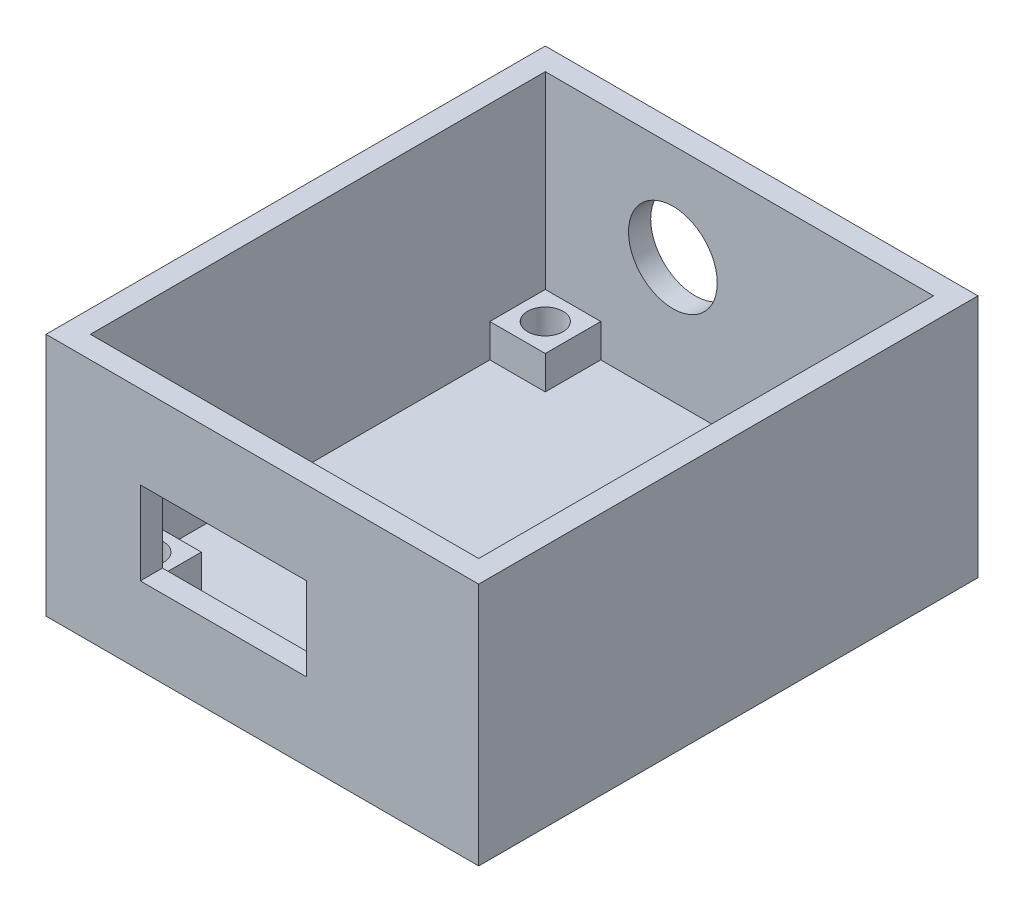
from build123d import *

# Parameters (mm, degrees)
SKETCH1_W             = 39
SKETCH1_H             = 45
BODY_DEPTH            = 22
SHELL1_T              = -2
SKETCH3_W             = 5
SKETCH3_H             = 5
INSERTS_SUPPORT_DEPTH = 3
SKETCH4_R             = 1.6
INSERTS_HOLES_DEPTH   = 4
USB_HOLE_REACH        = 55.752
SKETCH5_W             = 15
SKETCH5_H             = 7.5
JACK_HOLE_REACH       = 55.752
SKETCH6_R             = 4


with BuildPart() as part:
    # Sketch1 → Body (new body)
    with BuildSketch(Plane(origin=(0, 0, 0), x_dir=(1, 0, 0), z_dir=(0, 1, 0))):
        Rectangle(SKETCH1_W, SKETCH1_H)
    extrude(amount=BODY_DEPTH)

    # Shell1
    shell1_openings = [part.faces().sort_by_distance(p)[0] for p in [
        (0, 22, 0),
    ]]
    offset(amount=SHELL1_T, openings=shell1_openings, kind=Kind.INTERSECTION)

    # Sketch3 → Inserts_Support (add)
    with BuildSketch(Plane(origin=(0, 2, 0), x_dir=(1, 0, 0), z_dir=(0, 1, 0))):
        with Locations((-15, 18)):
            Rectangle(SKETCH3_W, SKETCH3_H)
        with Locations((15, 18)):
            Rectangle(SKETCH3_W, SKETCH3_H)
        with Locations((15, -18)):
            Rectangle(SKETCH3_W, SKETCH3_H)
        with Locations((-15, -18)):
            Rectangle(SKETCH3_W, SKETCH3_H)
    extrude(amount=INSERTS_SUPPORT_DEPTH)

    # Sketch4 → Inserts_Holes (cut)
    with BuildSketch(Plane(origin=(0, 5, 0), x_dir=(1, 0, 0), z_dir=(0, 1, 0))):
        with Locations((-15, 18)):
            Circle(SKETCH4_R)
        with Locations((15, 18)):
            Circle(SKETCH4_R)
        with Locations((15, -18)):
            Circle(SKETCH4_R)
        with Locations((-15, -18)):
            Circle(SKETCH4_R)
    extrude(amount=-INSERTS_HOLES_DEPTH, mode=Mode.SUBTRACT)

    # Sketch5 → USB_Hole (cut, up to next)
    with BuildSketch(Plane.XY.offset(22.5), mode=Mode.PRIVATE) as usb_hole_sk1:
        with Locations((-3.5, 10.75)):
            Rectangle(SKETCH5_W, SKETCH5_H)
    usb_hole_tool1 = extrude(usb_hole_sk1.sketch, amount=-USB_HOLE_REACH, mode=Mode.PRIVATE) & part.part
    add(usb_hole_tool1.solids().sort_by_distance((-3.5, 10.75, 22.5))[0], mode=Mode.SUBTRACT)

    # Sketch6 → Jack_Hole (cut, up to next)
    with BuildSketch(Plane(origin=(0, 0, -22.5), x_dir=(-1, 0, 0), z_dir=(0, 0, -1)), mode=Mode.PRIVATE) as jack_hole_sk1:
        with Locations((6, 13.25)):
            Circle(SKETCH6_R)
    jack_hole_tool1 = extrude(jack_hole_sk1.sketch, amount=-JACK_HOLE_REACH, mode=Mode.PRIVATE) & part.part
    add(jack_hole_tool1.solids().sort_by_distance((-6, 13.25, -22.5))[0], mode=Mode.SUBTRACT)


solid = part.part
